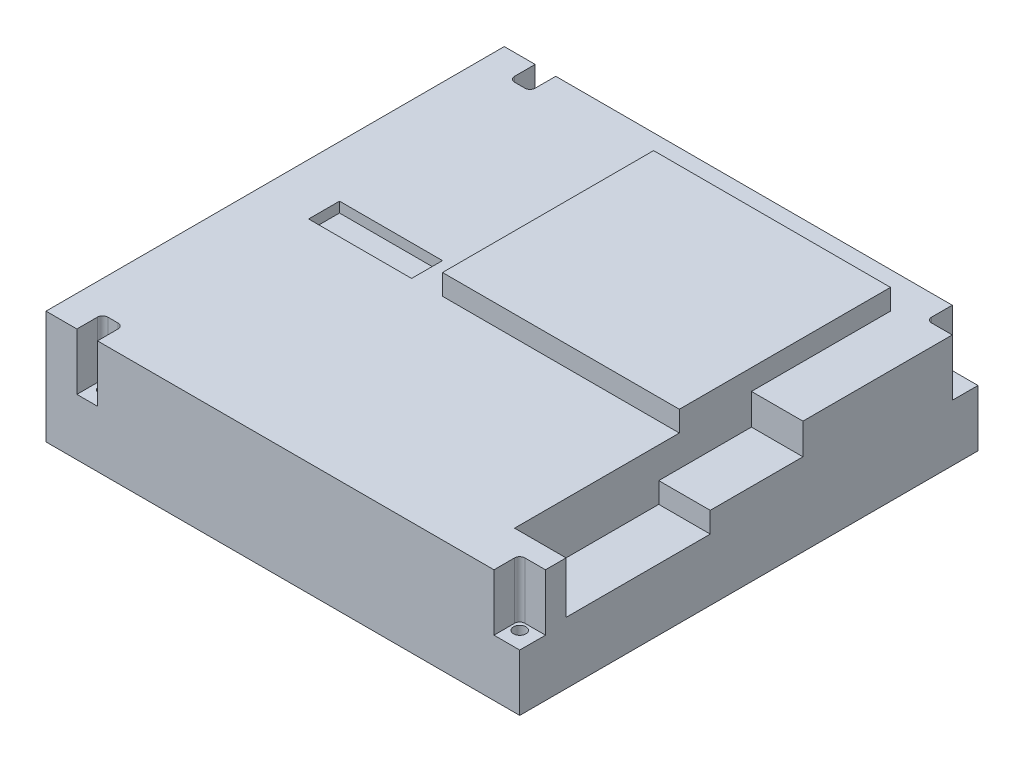
from build123d import *

# Parameters (mm, degrees)
SCHIZZO1_W                   = 46
SCHIZZO1_H                   = 44.5
ESTRUSIONE_ESTRUSIONE1_DEPTH = 11
SCHIZZO2_W                   = 23
SCHIZZO2_H                   = 20.5
ESTRUSIONE_ESTRUSIONE2_DEPTH = 2
TAGLIO_ESTRUSIONE1_DEPTH     = 5.5
SCHIZZO5_W                   = 38.5
SCHIZZO5_H                   = 9
TAGLIO_ESTRUSIONE2_DEPTH     = 1
SCHIZZO9_W                   = 10
SCHIZZO9_H                   = 3
TAGLIO_ESTRUSIONE4_DEPTH     = 1
SCHIZZO10_W                  = 5
SCHIZZO10_H                  = 23
TAGLIO_ESTRUSIONE5_DEPTH     = 3
SCHIZZO11_W                  = 5
SCHIZZO11_H                  = 14
TAGLIO_ESTRUSIONE6_DEPTH     = 2
FORO_PER_VITE_M1_2_D         = 1.2
SVUOTA3_OUTLINE_W            = 12
SVUOTA3_OUTLINE_H            = 5
SVUOTA3_DEPTH                = 10
SVUOTA3_2_OUTLINE_W          = 5
SVUOTA3_2_OUTLINE_H          = 25
SVUOTA3_2_OUTLINE_W_2        = 12
SVUOTA3_2_OUTLINE_H_2        = 5
SVUOTA3_2_DEPTH              = 5
SVUOTA3_START                = 10
SVUOTA3_3_OUTLINE_W          = 21
SVUOTA3_3_OUTLINE_H          = 18.5
SVUOTA3_3_DEPTH              = 2
SVUOTA3_START_2              = 5
SVUOTA3_4_OUTLINE_W          = 12
SVUOTA3_4_OUTLINE_H          = 5
SVUOTA3_4_DEPTH              = 4
SVUOTA3_5_OUTLINE_W          = 5
SVUOTA3_5_OUTLINE_H          = 9
SVUOTA3_5_DEPTH              = 2
SVUOTA3_6_DEPTH              = 4.5


# Read off the part's stored shape, not the designer's step: Svuota3
with BuildPart() as part:
    # Schizzo1 → Estrusione-Estrusione1 (new body)
    with BuildSketch(Plane(origin=(0, 0, 0), x_dir=(1, 0, 0), z_dir=(0, 1, 0))):
        Rectangle(SCHIZZO1_W, SCHIZZO1_H)
    extrude(amount=ESTRUSIONE_ESTRUSIONE1_DEPTH)

    # Schizzo2 → Estrusione-Estrusione2 (add)
    with BuildSketch(Plane(origin=(0, 11, 0), x_dir=(1, 0, 0), z_dir=(0, 1, 0))):
        with Locations((6.5, 8.5)):
            Rectangle(SCHIZZO2_W, SCHIZZO2_H)
    extrude(amount=ESTRUSIONE_ESTRUSIONE2_DEPTH)

    # Schizzo3 → Taglio-Estrusione1 (cut)
    with BuildSketch(Plane(origin=(0, 11, 0), x_dir=(1, 0, 0), z_dir=(0, 1, 0))):
        with BuildLine():
            Line((23, 22.25), (20.5, 22.25))
            Line((20.5, 22.25), (20.5, 20.25))
            ThreePointArc((20.5, 20.25), (20.646446609, 19.896446609), (21, 19.75))
            Line((21, 19.75), (23, 19.75))
            Line((23, 19.75), (23, 22.25))
        make_face()
        with BuildLine():
            Line((23, -22.25), (20.5, -22.25))
            Line((20.5, -22.25), (20.5, -20.25))
            ThreePointArc((20.5, -20.25), (20.646446609, -19.896446609), (21, -19.75))
            Line((21, -19.75), (23, -19.75))
            Line((23, -19.75), (23, -22.25))
        make_face()
        with BuildLine():
            Line((-20, 22.25), (-18, 22.25))
            Line((-18, 22.25), (-18, 20.25))
            ThreePointArc((-18, 20.25), (-18.146446609, 19.896446609), (-18.5, 19.75))
            Line((-18.5, 19.75), (-19.5, 19.75))
            ThreePointArc((-19.5, 19.75), (-19.853553391, 19.896446609), (-20, 20.25))
            Line((-20, 20.25), (-20, 22.25))
        make_face()
        with BuildLine():
            Line((-20, -22.25), (-18, -22.25))
            Line((-18, -22.25), (-18, -20.25))
            ThreePointArc((-18, -20.25), (-18.146446609, -19.896446609), (-18.5, -19.75))
            Line((-18.5, -19.75), (-19.5, -19.75))
            ThreePointArc((-19.5, -19.75), (-19.853553391, -19.896446609), (-20, -20.25))
            Line((-20, -20.25), (-20, -22.25))
        make_face()
    extrude(amount=-TAGLIO_ESTRUSIONE1_DEPTH, mode=Mode.SUBTRACT)

    # Schizzo5 → Taglio-Estrusione2 (cut)
    with BuildSketch(Plane(origin=(-23, 0, -0.75), x_dir=(0, 0, -1), z_dir=(1, 0, 0))):
        with Locations((-0.75, 4.5)):
            Rectangle(SCHIZZO5_W, SCHIZZO5_H)
    extrude(amount=TAGLIO_ESTRUSIONE2_DEPTH, mode=Mode.SUBTRACT)

    # Schizzo9 → Taglio-Estrusione4 (cut)
    with BuildSketch(Plane(origin=(0, 11, 0), x_dir=(1, 0, 0), z_dir=(0, 1, 0))):
        with Locations((-13, -0.25)):
            Rectangle(SCHIZZO9_W, SCHIZZO9_H)
    extrude(amount=-TAGLIO_ESTRUSIONE4_DEPTH, mode=Mode.SUBTRACT)

    # Schizzo10 → Taglio-Estrusione5 (cut)
    with BuildSketch(Plane(origin=(0, 11, 0), x_dir=(1, 0, 0), z_dir=(0, 1, 0))):
        with Locations((20.5, -6.25)):
            Rectangle(SCHIZZO10_W, SCHIZZO10_H)
    extrude(amount=-TAGLIO_ESTRUSIONE5_DEPTH, mode=Mode.SUBTRACT)

    # Schizzo11 → Taglio-Estrusione6 (cut)
    with BuildSketch(Plane(origin=(0, 8, 0), x_dir=(1, 0, 0), z_dir=(0, 1, 0))):
        with Locations((20.5, -10.75)):
            Rectangle(SCHIZZO11_W, SCHIZZO11_H)
    extrude(amount=-TAGLIO_ESTRUSIONE6_DEPTH, mode=Mode.SUBTRACT)

    # Foro per Vite M1-2 (through all)
    with Locations(Plane(origin=(0, 5.5, 0), x_dir=(1, 0, 0), z_dir=(0, 1, 0))):
        with Locations((21.34, -20.59), (21.335553897, 20.599331768), (-19, 20.5), (-19, -20.5)):
            Hole(FORO_PER_VITE_M1_2_D / 2)

    # Svuota3 outline → Svuota3 (cut)
    with BuildSketch(Plane(origin=(0, 0, 0), x_dir=(1, 0, 0), z_dir=(0, 1, 0))):
        with BuildLine():
            Line((22, 6.25), (22, 18.75))
            Line((22, 18.75), (21, 18.75))
            ThreePointArc((21, 18.75), (19.939339828, 19.189339828), (19.5, 20.25))
            Line((19.5, 20.25), (19.5, 21.25))
            Line((19.5, 21.25), (-17, 21.25))
            Line((-17, 21.25), (-17, 20.25))
            ThreePointArc((-17, 20.25), (-17.439339828, 19.189339828), (-18.5, 18.75))
            Line((-18.5, 18.75), (-19.5, 18.75))
            ThreePointArc((-19.5, 18.75), (-20.560660172, 19.189339828), (-21, 20.25))
            Line((-21, 20.25), (-21, 21.25))
            Line((-21, 21.25), (-22, 21.25))
            Line((-22, 21.25), (-22, -21.25))
            Line((-22, -21.25), (-21, -21.25))
            Line((-21, -21.25), (-21, -20.25))
            ThreePointArc((-21, -20.25), (-20.560660172, -19.189339828), (-19.5, -18.75))
            Line((-19.5, -18.75), (-18.5, -18.75))
            ThreePointArc((-18.5, -18.75), (-17.439339828, -19.189339828), (-17, -20.25))
            Line((-17, -20.25), (-17, -21.25))
            Line((-17, -21.25), (19.5, -21.25))
            Line((19.5, -21.25), (19.5, -20.25))
            ThreePointArc((19.5, -20.25), (19.939339828, -19.189339828), (21, -18.75))
            Line((21, -18.75), (17, -18.75))
            Line((17, -18.75), (17, 6.25))
            Line((17, 6.25), (22, 6.25))
        make_face()
        with Locations((-13, -0.25)):
            Rectangle(SVUOTA3_OUTLINE_W, SVUOTA3_OUTLINE_H, mode=Mode.SUBTRACT)
    extrude(amount=SVUOTA3_DEPTH, mode=Mode.SUBTRACT)

    # Svuota3 2 outline → Svuota3 2 (cut)
    with BuildSketch(Plane(origin=(0, 0, 0), x_dir=(1, 0, 0), z_dir=(0, 1, 0))):
        with Locations((19.5, -6.25)):
            Rectangle(SVUOTA3_2_OUTLINE_W, SVUOTA3_2_OUTLINE_H)
        with Locations((-13, -0.25)):
            Rectangle(SVUOTA3_2_OUTLINE_W_2, SVUOTA3_2_OUTLINE_H_2)
    extrude(amount=SVUOTA3_2_DEPTH, mode=Mode.SUBTRACT)

    # Svuota3 3 outline → Svuota3 3 (cut)
    with BuildSketch(Plane(origin=(0, 0, 0), x_dir=(1, 0, 0), z_dir=(0, 1, 0)).offset(SVUOTA3_START)):
        with Locations((6.5, 8.5)):
            Rectangle(SVUOTA3_3_OUTLINE_W, SVUOTA3_3_OUTLINE_H)
    extrude(amount=SVUOTA3_3_DEPTH, mode=Mode.SUBTRACT)

    # Svuota3 4 outline → Svuota3 4 (cut)
    with BuildSketch(Plane(origin=(0, 0, 0), x_dir=(1, 0, 0), z_dir=(0, 1, 0)).offset(SVUOTA3_START_2)):
        with Locations((-13, -0.25)):
            Rectangle(SVUOTA3_4_OUTLINE_W, SVUOTA3_4_OUTLINE_H)
    extrude(amount=SVUOTA3_4_DEPTH, mode=Mode.SUBTRACT)

    # Svuota3 5 outline → Svuota3 5 (cut)
    with BuildSketch(Plane(origin=(0, 0, 0), x_dir=(1, 0, 0), z_dir=(0, 1, 0)).offset(SVUOTA3_START_2)):
        with Locations((19.5, 1.75)):
            Rectangle(SVUOTA3_5_OUTLINE_W, SVUOTA3_5_OUTLINE_H)
    extrude(amount=SVUOTA3_5_DEPTH, mode=Mode.SUBTRACT)

    # Svuota3 6 outline → Svuota3 6 (cut)
    with BuildSketch(Plane(origin=(0, 0, 0), x_dir=(1, 0, 0), z_dir=(0, 1, 0))):
        with BuildLine():
            Line((22, 18.75), (22, 19.143821075))
            ThreePointArc((22, 19.143821075), (20.209538985, 19.462630216), (19.873832018, 21.25))
            Line((19.873832018, 21.25), (19.5, 21.25))
            Line((19.5, 21.25), (19.5, 20.25))
            ThreePointArc((19.5, 20.25), (19.939339828, 19.189339828), (21, 18.75))
            Line((21, 18.75), (22, 18.75))
        make_face()
        with BuildLine():
            Line((-17, 20.25), (-17, 21.25))
            Line((-17, 21.25), (-17.586670597, 21.25))
            ThreePointArc((-17.586670597, 21.25), (-19, 18.9), (-20.413329403, 21.25))
            Line((-20.413329403, 21.25), (-21, 21.25))
            Line((-21, 21.25), (-21, 20.25))
            ThreePointArc((-21, 20.25), (-20.560660172, 19.189339828), (-19.5, 18.75))
            Line((-19.5, 18.75), (-18.5, 18.75))
            ThreePointArc((-18.5, 18.75), (-17.439339828, 19.189339828), (-17, 20.25))
        make_face()
        with BuildLine():
            Line((22, -19.132467839), (22, -18.75))
            Line((22, -18.75), (21, -18.75))
            ThreePointArc((21, -18.75), (19.939339828, -19.189339828), (19.5, -20.25))
            Line((19.5, -20.25), (19.5, -21.25))
            Line((19.5, -21.25), (19.882467839, -21.25))
            ThreePointArc((19.882467839, -21.25), (20.20862915, -19.45862915), (22, -19.132467839))
        make_face()
        with BuildLine():
            Line((-17.586670597, -21.25), (-17, -21.25))
            Line((-17, -21.25), (-17, -20.25))
            ThreePointArc((-17, -20.25), (-17.439339828, -19.189339828), (-18.5, -18.75))
            Line((-18.5, -18.75), (-19.5, -18.75))
            ThreePointArc((-19.5, -18.75), (-20.560660172, -19.189339828), (-21, -20.25))
            Line((-21, -20.25), (-21, -21.25))
            Line((-21, -21.25), (-20.413329403, -21.25))
            ThreePointArc((-20.413329403, -21.25), (-19, -18.9), (-17.586670597, -21.25))
        make_face()
    extrude(amount=SVUOTA3_6_DEPTH, mode=Mode.SUBTRACT)


solid = part.part
